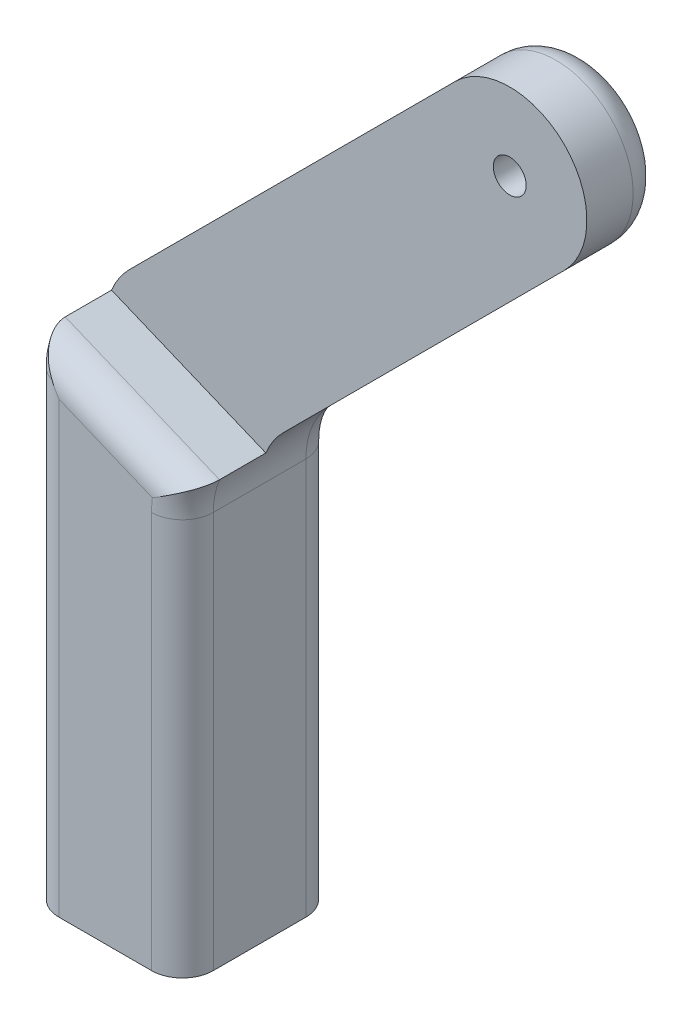
from build123d import *

# Parameters (mm, degrees)
EXTRUDE_1_DEPTH     = 15
SKETCH_2_R          = 3.1
CUT_EXTRUDE_1_DEPTH = 12
CUT_EXTRUDE_START   = -7.5
CUT_EXTRUDE_2_DEPTH = 7.5
SKETCH_4_R          = 1.6
CUT_EXTRUDE_3_DEPTH = 8
CUT_EXTRUDE_4_DEPTH = 3
FILLET_1_R          = 3


with BuildPart() as part:
    # Model → 凸台-拉伸1 (new body)
    with BuildSketch(Plane.XY):
        with BuildLine():
            Line((113.596149123, 231.939716908), (128.596149123, 231.939716908))
            Line((128.596149123, 231.939716908), (128.596149123, 270.519406691))
            ThreePointArc((128.596149123, 270.519406691), (129.205112863, 273.58087415), (130.939294874, 276.17626094))
            Line((130.939294874, 276.17626094), (158.219255135, 303.456221202))
            ThreePointArc((158.219255135, 303.456221202), (158.219255135, 314.06282292), (147.612653418, 314.06282292))
            Line((147.612653418, 314.06282292), (115.939294874, 282.389464376))
            ThreePointArc((115.939294874, 282.389464376), (114.205112863, 279.794077585), (113.596149123, 276.732610126))
            Line((113.596149123, 276.732610126), (113.596149123, 231.939716908))
        make_face()
    extrude(amount=EXTRUDE_1_DEPTH)

    # 草图2 → 切除-拉伸1 (cut)
    with BuildSketch(Plane.XZ.offset(-231.939716908)):
        with Locations(Location((121.096149123, 7.5, 0), (0, 0, 270))):
            Circle(SKETCH_2_R)
    extrude(amount=-CUT_EXTRUDE_1_DEPTH, mode=Mode.SUBTRACT)

    # 草图3 → 切除-拉伸2 (cut)
    with BuildSketch(Plane.XY.offset(15).offset(CUT_EXTRUDE_START)):
        with BuildLine():
            Line((114.205112863, 279.794077585), (129.205112863, 273.58087415))
            ThreePointArc((129.205112863, 273.58087415), (129.944392225, 274.963968555), (130.939294874, 276.17626094))
            Line((130.939294874, 276.17626094), (158.219255135, 303.456221202))
            ThreePointArc((158.219255135, 303.456221202), (158.219255135, 314.06282292), (147.612653418, 314.06282292))
            Line((147.612653418, 314.06282292), (115.939294874, 282.389464376))
            ThreePointArc((115.939294874, 282.389464376), (114.944392225, 281.17717199), (114.205112863, 279.794077585))
        make_face()
    extrude(amount=CUT_EXTRUDE_2_DEPTH, mode=Mode.SUBTRACT)

    # 草图4 → 切除-拉伸3 (cut)
    with BuildSketch(Plane.XY.offset(7.5)):
        with Locations((152.915954276, 308.759522061)):
            Circle(SKETCH_4_R)
    extrude(amount=-CUT_EXTRUDE_3_DEPTH, mode=Mode.SUBTRACT)

    # 草图5 → 切除-拉伸4 (cut)
    with BuildSketch(Plane(origin=(0, 0, 0), x_dir=(-1, 0, 0), z_dir=(0, 0, -1))):
        Polygon((-149.682792769, 308.759522061), (-151.299373523, 311.559522061), (-154.53253503, 311.559522061), (-156.149115784, 308.759522061), (-154.53253503, 305.959522061), (-151.299373523, 305.959522061), align=None)
    extrude(amount=-CUT_EXTRUDE_4_DEPTH, mode=Mode.SUBTRACT)

    # 圆角1
    # the kernel refuses this fillet: 3 mm, written as the material it takes off along each edge
    with BuildSketch(Plane(origin=(113.596149123, 276.732610126, 0), x_dir=(0, 0, 1), z_dir=(0, -1, 0))) as fillet_1_piece_1:
        with BuildLine():
            CenterArc((FILLET_1_R, -FILLET_1_R), FILLET_1_R, 90, 90)
            Line((0, -FILLET_1_R), (0, 0))
            Line((0, 0), (FILLET_1_R, 0))
        make_face()
    extrude(amount=52.292893219, mode=Mode.SUBTRACT)
    with BuildSketch(Plane(origin=(121.596149123, 276.732610126, 0), x_dir=(-0.7071067811865422, 0.7071067811865529, 0), z_dir=(0.7071067811865529, 0.7071067811865422, 0))) as fillet_1_piece_2:
        with BuildLine():
            CenterArc((8 - FILLET_1_R, FILLET_1_R), FILLET_1_R, 270, 90)
            Line((8, FILLET_1_R), (8, 0))
            Line((8, 0), (8 - FILLET_1_R, 0))
        make_face()
    revolve(axis=Axis((121.596149123, 276.732610126, 0), (0, 0, 1)), revolution_arc=45, mode=Mode.SUBTRACT)
    with BuildSketch(Plane(origin=(147.612653418, 314.06282292, 0), x_dir=(0.7071067811865483, -0.7071067811865468, 0), z_dir=(-0.7071067811865469, -0.7071067811865482, 0))) as fillet_1_piece_3:
        with BuildLine():
            CenterArc((FILLET_1_R, FILLET_1_R), FILLET_1_R, 180, 90)
            Line((0, FILLET_1_R), (0, 0))
            Line((0, 0), (FILLET_1_R, 0))
        make_face()
    extrude(amount=44.792893219, mode=Mode.SUBTRACT)
    with BuildSketch(Plane(origin=(152.915954276, 308.759522061, 0), x_dir=(0.7071067811865419, -0.7071067811865532, 0), z_dir=(-0.7071067811865532, -0.7071067811865419, 0))) as fillet_1_piece_4:
        with BuildLine():
            CenterArc((7.5 - FILLET_1_R, FILLET_1_R), FILLET_1_R, 270, 90)
            Line((7.5, FILLET_1_R), (7.5, 0))
            Line((7.5, 0), (7.5 - FILLET_1_R, 0))
        make_face()
    revolve(axis=Axis((152.915954276, 308.759522061, 0), (0, 0, 1)), revolution_arc=180, mode=Mode.SUBTRACT)
    with BuildSketch(Plane(origin=(130.939294874, 276.17626094, 0), x_dir=(-0.707106781186548, 0.7071067811865471, 0), z_dir=(0.7071067811865471, 0.7071067811865479, 0))) as fillet_1_piece_5:
        with BuildLine():
            CenterArc((FILLET_1_R, FILLET_1_R), FILLET_1_R, 180, 90)
            Line((0, FILLET_1_R), (0, 0))
            Line((0, 0), (FILLET_1_R, 0))
        make_face()
    extrude(amount=38.579689783, mode=Mode.SUBTRACT)
    with BuildSketch(Plane(origin=(136.596149123, 270.519406691, 0), x_dir=(-1, 0, 0), z_dir=(0, -1, 0))) as fillet_1_piece_6:
        with BuildLine():
            CenterArc((8 + FILLET_1_R, -FILLET_1_R), FILLET_1_R, 90, 90)
            Line((8, -FILLET_1_R), (8, 0))
            Line((8, 0), (8 + FILLET_1_R, 0))
        make_face()
    revolve(axis=Axis((136.596149123, 270.519406691, 0), (0, 0, -1)), revolution_arc=45, mode=Mode.SUBTRACT)
    with BuildSketch(Plane(origin=(136.596149123, 270.519406691, 15), x_dir=(-1, 0, 0), z_dir=(0, -1, 0))) as fillet_1_piece_7:
        with BuildLine():
            CenterArc((8 + FILLET_1_R, FILLET_1_R), FILLET_1_R, 180, 90)
            Line((8, FILLET_1_R), (8, 0))
            Line((8, 0), (8 + FILLET_1_R, 0))
        make_face()
    revolve(axis=Axis((136.596149123, 270.519406691, 15), (0, 0, -1)), revolution_arc=76.216141543, mode=Mode.SUBTRACT)
    with BuildSketch(Plane(origin=(128.596149123, 224.439716908, 0), x_dir=(-1, 0, 0), z_dir=(0, 1, 0))) as fillet_1_piece_8:
        with BuildLine():
            CenterArc((FILLET_1_R, FILLET_1_R), FILLET_1_R, 180, 90)
            Line((0, FILLET_1_R), (0, 0))
            Line((0, 0), (FILLET_1_R, 0))
        make_face()
    extrude(amount=46.079689783, mode=Mode.SUBTRACT)
    with BuildSketch(Plane(origin=(128.596149123, 224.439716908, 15), x_dir=(-1, 0, 0), z_dir=(0, 1, 0))) as fillet_1_piece_9:
        with BuildLine():
            CenterArc((FILLET_1_R, -FILLET_1_R), FILLET_1_R, 90, 90)
            Line((0, -FILLET_1_R), (0, 0))
            Line((0, 0), (FILLET_1_R, 0))
        make_face()
    extrude(amount=46.079689783, mode=Mode.SUBTRACT)
    with BuildSketch(Plane(origin=(107.276016369, 282.664203328, 15), x_dir=(-0.38268343236508984, -0.9238795325112866, 0), z_dir=(0.9238795325112867, -0.38268343236508984, 0))) as fillet_1_piece_10:
        with BuildLine():
            CenterArc((FILLET_1_R, FILLET_1_R), FILLET_1_R, 180, 90)
            Line((0, FILLET_1_R), (0, 0))
            Line((0, 0), (FILLET_1_R, 0))
        make_face()
    extrude(amount=31.235883004, mode=Mode.SUBTRACT)
    with BuildSketch(Plane(origin=(113.596149123, 276.732610126, 15), x_dir=(0, 0, -1), z_dir=(0, -1, 0))) as fillet_1_piece_11:
        with BuildLine():
            CenterArc((FILLET_1_R, FILLET_1_R), FILLET_1_R, 180, 90)
            Line((0, FILLET_1_R), (0, 0))
            Line((0, 0), (FILLET_1_R, 0))
        make_face()
    extrude(amount=52.292893219, mode=Mode.SUBTRACT)
    with BuildSketch(Plane(origin=(121.596149123, 276.732610126, 15), x_dir=(-0.23825985719225534, 0.9712014417466266, 0), z_dir=(0.9712014417466266, 0.23825985719225534, 0))) as fillet_1_piece_12:
        with BuildLine():
            CenterArc((8 - FILLET_1_R, -FILLET_1_R), FILLET_1_R, 0, 90)
            Line((8, -FILLET_1_R), (8, 0))
            Line((8, 0), (8 - FILLET_1_R, 0))
        make_face()
    revolve(axis=Axis((121.596149123, 276.732610126, 15), (0, 0, 1)), revolution_arc=76.216141543, mode=Mode.SUBTRACT)


solid = part.part
